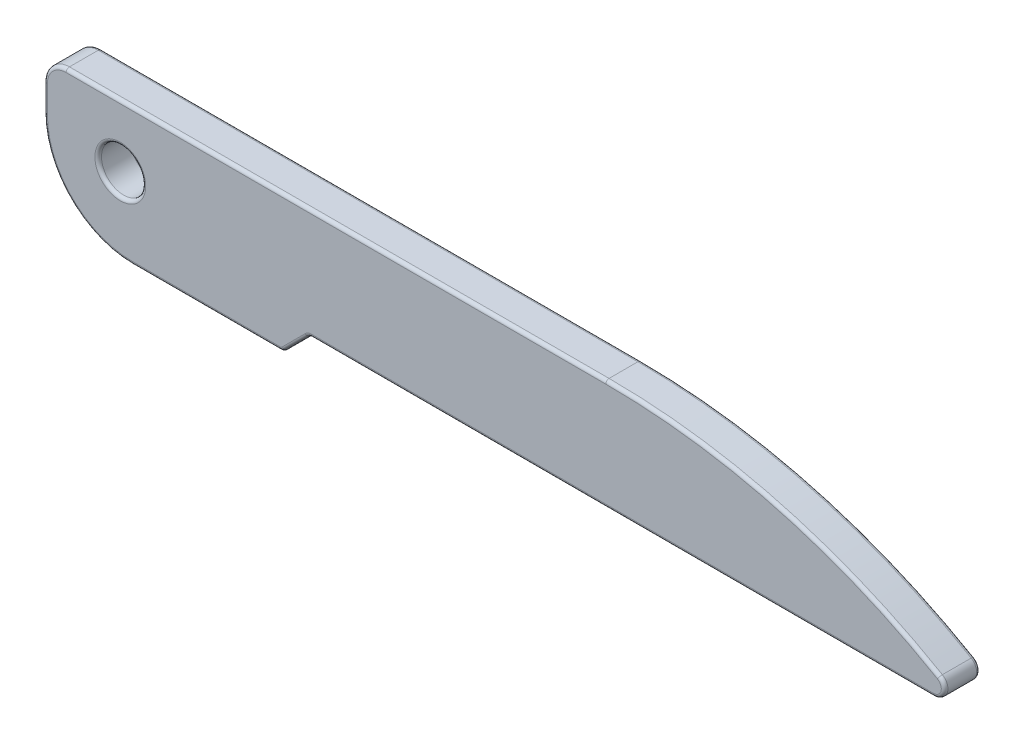
from build123d import *

# Parameters (mm, degrees)
BOSS_EXTRUDE1_DEPTH = 1.6
FILLET1_R           = 0.5
FILLET2_R           = 0.25
FILLET3_R           = 0.15
CUT_EXTRUDE1_DEPTH  = 0.3
FILLET4_R           = 4
SKETCH3_R           = 1
CUT_EXTRUDE2_DEPTH  = 42.249281937
FILLET5_R           = 4
FILLET6_R           = 1
FILLET7_R           = 0.15


with BuildPart() as part:
    # Sketch1 → Boss-Extrude1 (new body)
    with BuildSketch(Plane.XY):
        with BuildLine():
            Line((0, 0), (0, 6.2))
            Line((0, 6.2), (25.416876048, 6.2))
            ThreePointArc((25.416876048, 6.2), (34.077130086, 4.922813233), (42, 1.2))
            Line((42, 1.2), (12, 1.2))
            Line((12, 1.2), (10.8, 0))
            Line((10.8, 0), (0, 0))
        make_face()
    extrude(amount=BOSS_EXTRUDE1_DEPTH)

    # Fillet1
    fillet1_edges = [part.edges().sort_by_distance(p)[0] for p in [
        (42, 1.2, 0.8),
    ]]
    fillet(fillet1_edges, radius=FILLET1_R)

    # Fillet2
    fillet2_edges = [part.edges().sort_by_distance(p)[0] for p in [
        (12, 1.2, 0.8),
        (10.8, 0, 0.8),
    ]]
    fillet(fillet2_edges, radius=FILLET2_R)

    # Fillet3
    fillet3_edges = [part.edges().sort_by_distance(p)[0] for p in [
        (12.708438024, 6.2, 1.6),
        (33.228210707, 5.16520414, 0),
        (33.228210707, 5.16520414, 1.6),
        (0, 3.1, 1.6),
        (40.732026425, 1.569811089, 0),
        (40.732026425, 1.569811089, 1.6),
        (11.4, 0.6, 0),
        (11.4, 0.6, 1.6),
        (26.176413207, 1.2, 0),
        (10.792117467, 0.019030117, 0),
        (26.176413207, 1.2, 1.6),
        (10.792117467, 0.019030117, 1.6),
        (12.007882533, 1.180969883, 0),
        (12.007882533, 1.180969883, 1.6),
        (5.348223305, 0, 1.6),
        (0, 3.1, 0),
        (12.708438024, 6.2, 0),
        (5.348223305, 0, 0),
    ]]
    fillet(fillet3_edges, radius=FILLET3_R)

    # Sketch2 → Cut-Extrude1 (cut)
    with BuildSketch(Plane(origin=(0, 0, 0), x_dir=(-1, 0, 0), z_dir=(0, 0, -1))):
        with BuildLine():
            Line((-16.416876048, 5.55), (-28.416876048, 5.55))
            ThreePointArc((-28.416876048, 5.55), (-22.416876048, 4.297727085), (-16.416876048, 5.55))
        make_face()
    extrude(amount=-CUT_EXTRUDE1_DEPTH, mode=Mode.SUBTRACT)

    # Fillet4
    # the kernel refuses this fillet: 4 mm, written as the material it adds along each edge
    with BuildSketch(Plane(origin=(22.416876048, 19.297727085, 0.3), x_dir=(0.6169459509621767, -0.7870055232279983, 0), z_dir=(0.7870055232279983, 0.6169459509621767, 0))) as fillet4_piece_1_section:
        with BuildLine():
            CenterArc((13.480131585, 4), FILLET4_R, 270, 22.331645009)
            Line((13.480131585, 0), (13.480131585, -0.08))
            Line((13.480131585, -0.08), (15, -0.08))
            Line((15, -0.08), (15.08, 0))
            ThreePointArc((15.08, 0), (15.08, 0.15), (15.030397368, 0.226))
            Line((15.030397368, 0.226), (15, 0.3))
        make_face()
    fillet4_piece_1 = revolve(axis=Axis((22.416876048, 19.297727085, 0.3), (0, 0, -1)), revolution_arc=76.186906047, mode=Mode.PRIVATE)
    fillet4_piece_1 = split(fillet4_piece_1, bisect_by=Plane(origin=(22.416876137, 5.55, 0.246369344), z_dir=(0, -1, 0)), keep=Keep.TOP, mode=Mode.PRIVATE)
    add(fillet4_piece_1)

    # Sketch3 → Cut-Extrude2 (cut, through all)
    with BuildSketch(Plane(origin=(0, 0, 0), x_dir=(-1, 0, 0), z_dir=(0, 0, -1))):
        with Locations((-3.45, 3.4)):
            Circle(SKETCH3_R)
    extrude(amount=-CUT_EXTRUDE2_DEPTH, mode=Mode.SUBTRACT)

    # Fillet5
    # the kernel refuses this fillet: 4 mm, written as the material it takes off along each edge
    with BuildSketch(Plane(origin=(4, 4, 0), x_dir=(0, -1, 0), z_dir=(1, 0, 0))) as fillet5_piece_1:
        with BuildLine():
            CenterArc((3.85, -0.15), 0.15, 0, 90)
            Line((4, -0.15), (4, 0))
            Line((4, 0), (3.85, 0))
        make_face()
    revolve(axis=Axis((4, 4, 0), (0, 0, -1)), revolution_arc=90, mode=Mode.SUBTRACT)
    with BuildSketch(Plane(origin=(4, 4, 1.6), x_dir=(-1, 0, 0), z_dir=(0, 1, 0))) as fillet5_piece_2:
        with BuildLine():
            CenterArc((3.85, -0.15), 0.15, 0, 90)
            Line((4, -0.15), (4, 0))
            Line((4, 0), (3.85, 0))
        make_face()
    revolve(axis=Axis((4, 4, 1.6), (0, 0, 1)), revolution_arc=90, mode=Mode.SUBTRACT)
    with BuildSketch(Plane(origin=(0, 0, 0), x_dir=(0, 1, 0), z_dir=(0, 0, 1))) as fillet5_piece_3:
        with BuildLine():
            CenterArc((FILLET5_R, -FILLET5_R), FILLET5_R, 90, 90)
            Line((0, -FILLET5_R), (0, 0))
            Line((0, 0), (FILLET5_R, 0))
        make_face()
    extrude(amount=1.6, mode=Mode.SUBTRACT)

    # Fillet6
    # the kernel refuses this fillet: 1 mm, written as the material it takes off along each edge
    with BuildSketch(Plane(origin=(1, 5.2, 0), x_dir=(-1, 0, 0), z_dir=(0, -1, 0))) as fillet6_piece_1:
        with BuildLine():
            CenterArc((0.85, -0.15), 0.15, 0, 90)
            Line((1, -0.15), (1, 0))
            Line((1, 0), (0.85, 0))
        make_face()
    revolve(axis=Axis((1, 5.2, 0), (0, 0, -1)), revolution_arc=90, mode=Mode.SUBTRACT)
    with BuildSketch(Plane(origin=(1, 5.2, 1.6), x_dir=(0, 1, 0), z_dir=(1, 0, 0))) as fillet6_piece_2:
        with BuildLine():
            CenterArc((0.85, -0.15), 0.15, 0, 90)
            Line((1, -0.15), (1, 0))
            Line((1, 0), (0.85, 0))
        make_face()
    revolve(axis=Axis((1, 5.2, 1.6), (0, 0, 1)), revolution_arc=90, mode=Mode.SUBTRACT)
    with BuildSketch(Plane(origin=(0, 6.2, 0), x_dir=(0, -1, 0), z_dir=(0, 0, 1))) as fillet6_piece_3:
        with BuildLine():
            CenterArc((FILLET6_R, FILLET6_R), FILLET6_R, 180, 90)
            Line((0, FILLET6_R), (0, 0))
            Line((0, 0), (FILLET6_R, 0))
        make_face()
    extrude(amount=1.6, mode=Mode.SUBTRACT)

    # Fillet7
    fillet7_edges = [part.edges().sort_by_distance(p)[0] for p in [
        (4.45, 3.4, 1.6),
        (4.45, 3.4, 0),
    ]]
    fillet(fillet7_edges, radius=FILLET7_R)


solid = part.part
